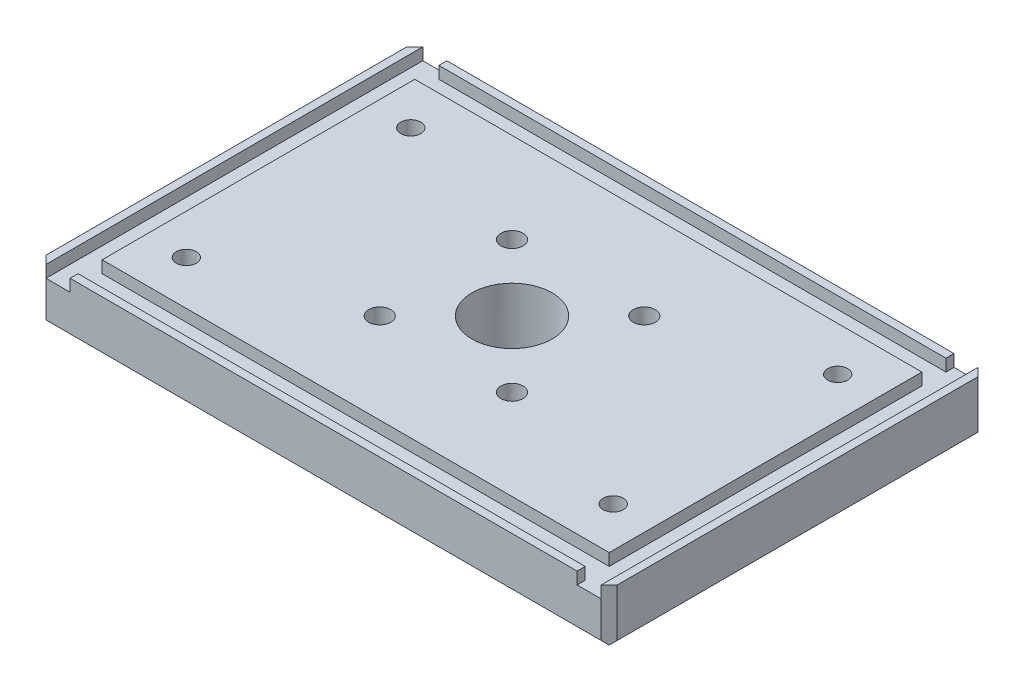
from build123d import *

# Parameters (mm, degrees)
SKETCH1_W           = 142.5
SKETCH1_H           = 94
BOSS_EXTRUDE1_DEPTH = 15
SKETCH2_W           = 126.5
SKETCH2_H           = 78
CUT_EXTRUDE2_DEPTH  = 3
CHAMFER1_SIZE       = 2
SKETCH6_R           = 2.5
CUT_EXTRUDE7_DEPTH  = 10
SKETCH7_R           = 5
CUT_EXTRUDE8_DEPTH  = 5
CHAMFER2_SIZE       = 3
SKETCH8_R           = 10
CUT_EXTRUDE9_DEPTH  = 15
CUT_EXTRUDE10_DEPTH = 172.368754445


# Some blends are built 0.0001 mm under size
with BuildPart() as part:
    # Sketch1 → Boss-Extrude1 (new body)
    with BuildSketch(Plane(origin=(0, 0, 0), x_dir=(1, 0, 0), z_dir=(0, 1, 0))):
        with Locations((71.25, 47)):
            Rectangle(SKETCH1_W, SKETCH1_H)
    extrude(amount=BOSS_EXTRUDE1_DEPTH)

    # Sketch2 → Cut-Extrude2 (cut)
    with BuildSketch(Plane(origin=(0, 15, 0), x_dir=(1, 0, 0), z_dir=(0, 1, 0))):
        Polygon((134.5, 92), (8, 92), (8, 94), (2, 94), (2, 0), (8, 0), (8, 2), (134.5, 2), (134.5, 0), (140.5, 0), (140.5, 94), (134.5, 94), align=None)
        with Locations((71.25, 47)):
            Rectangle(SKETCH2_W, SKETCH2_H, mode=Mode.SUBTRACT)
    extrude(amount=-CUT_EXTRUDE2_DEPTH, mode=Mode.SUBTRACT)

    # Chamfer1
    chamfer1_edges = [part.edges().sort_by_distance(p)[0] for p in [
        (0, 7.5, 0),
        (0, 7.5, -94),
        (142.5, 7.5, -94),
        (142.5, 7.5, 0),
    ]]
    chamfer(chamfer1_edges, length=CHAMFER1_SIZE - 0.0001)  # a hair under: the kernel refuses the full size

    # Sketch6 → Cut-Extrude7 (cut)
    with BuildSketch(Plane(origin=(0, 15, 0), x_dir=(1, 0, 0), z_dir=(0, 1, 0))):
        with Locations(Location((124.5, 75, 0), (0, 0, 270))):
            Circle(SKETCH6_R)
        with Locations(Location((18, 75, 0), (0, 0, 270))):
            Circle(SKETCH6_R)
        with Locations(Location((18, 19, 0), (0, 0, 270))):
            Circle(SKETCH6_R)
        with Locations(Location((124.5, 19, 0), (0, 0, 270))):
            Circle(SKETCH6_R)
    extrude(amount=-CUT_EXTRUDE7_DEPTH, mode=Mode.SUBTRACT)

    # Sketch7 → Cut-Extrude8 (cut)
    with BuildSketch(Plane.XZ):
        with Locations(Location((18, -19, 0), (0, 0, 270))):
            Circle(SKETCH7_R)
        with Locations(Location((124.5, -19, 0), (0, 0, 270))):
            Circle(SKETCH7_R)
        with Locations(Location((18, -75, 0), (0, 0, 270))):
            Circle(SKETCH7_R)
        with Locations(Location((124.5, -75, 0), (0, 0, 270))):
            Circle(SKETCH7_R)
    extrude(amount=-CUT_EXTRUDE8_DEPTH, mode=Mode.SUBTRACT)

    # Chamfer2
    # the kernel refuses this chamfer: 3 mm, written as the material it takes off along each edge
    with BuildSketch(Plane(origin=(142.5, 0, 5.715148964), x_dir=(-0.9996219169112968, -0.027495876610586487, 0), z_dir=(0, 0, -1)), Plane(origin=(0, 0, -99.715148964), x_dir=(0.9996219169112968, -0.027495876610586372, 0), z_dir=(0, 0, 1))) as chamfer2_piece_1:
        Polygon((CHAMFER2_SIZE * 0.999621916911, CHAMFER2_SIZE * 0.0274958766106), (-CHAMFER2_SIZE * 0.0274958766106, CHAMFER2_SIZE * 0.999621916911), (0, 0), align=None)
    extrude(amount=105.430297928, mode=Mode.SUBTRACT)
    with BuildSketch(Plane(origin=(-5.715148964, 0, 0), x_dir=(0, 0.9996219169112968, 0.027495876610586372), z_dir=(1, 0, 0))) as chamfer2_piece_2:
        Polygon((CHAMFER2_SIZE * 0.999621916911, -CHAMFER2_SIZE * 0.0274958766106), (-CHAMFER2_SIZE * 0.0274958766106, -CHAMFER2_SIZE * 0.999621916911), (0, 0), align=None)
    extrude(amount=153.930297928, mode=Mode.SUBTRACT)
    with BuildSketch(Plane(origin=(148.215148964, 0, -94), x_dir=(0, -0.02749587661058636, 0.9996219169112968), z_dir=(-1, 0, 0))) as chamfer2_piece_3:
        Polygon((CHAMFER2_SIZE * 0.999621916911, CHAMFER2_SIZE * 0.0274958766106), (-CHAMFER2_SIZE * 0.0274958766106, CHAMFER2_SIZE * 0.999621916911), (0, 0), align=None)
    extrude(amount=153.930297928, mode=Mode.SUBTRACT)

    # Sketch8 → Cut-Extrude9 (cut)
    with BuildSketch(Plane(origin=(0, 15, 0), x_dir=(1, 0, 0), z_dir=(0, 1, 0))):
        with Locations(Location((71.25, 47, 0), (0, 0, 270))):
            Circle(SKETCH8_R)
    extrude(amount=-CUT_EXTRUDE9_DEPTH, mode=Mode.SUBTRACT)

    # Sketch9 → Cut-Extrude10 (cut, through all)
    with BuildSketch(Plane(origin=(0, 15, 0), x_dir=(1, 0, 0), z_dir=(0, 1, 0))):
        with BuildLine():
            Line((54.75, 60.75), (54.75, 63.5))
            Line((54.75, 63.5), (57.5, 63.5))
            ThreePointArc((57.5, 63.5), (52.805456352, 65.444543648), (54.75, 60.75))
        make_face()
        with BuildLine():
            Line((57.5, 63.5), (54.75, 63.5))
            Line((54.75, 63.5), (54.75, 60.75))
            ThreePointArc((54.75, 60.75), (56.694543648, 61.555456352), (57.5, 63.5))
        make_face()
        with BuildLine():
            ThreePointArc((57.5, 30.5), (56.694543648, 32.444543648), (54.75, 33.25))
            Line((54.75, 33.25), (54.75, 30.5))
            Line((54.75, 30.5), (57.5, 30.5))
        make_face()
        with BuildLine():
            Line((54.75, 30.5), (54.75, 33.25))
            ThreePointArc((54.75, 33.25), (52.805456352, 28.555456352), (57.5, 30.5))
            Line((57.5, 30.5), (54.75, 30.5))
        make_face()
        with BuildLine():
            ThreePointArc((90.5, 30.5), (89.694543648, 32.444543648), (87.75, 33.25))
            Line((87.75, 33.25), (87.75, 30.5))
            Line((87.75, 30.5), (85, 30.5))
            ThreePointArc((85, 30.5), (87.75, 27.75), (90.5, 30.5))
        make_face()
        with BuildLine():
            Line((87.75, 30.5), (87.75, 33.25))
            ThreePointArc((87.75, 33.25), (85.805456352, 32.444543648), (85, 30.5))
            Line((85, 30.5), (87.75, 30.5))
        make_face()
        with BuildLine():
            ThreePointArc((90.5, 63.5), (87.75, 66.25), (85, 63.5))
            Line((85, 63.5), (87.75, 63.5))
            Line((87.75, 63.5), (87.75, 60.75))
            ThreePointArc((87.75, 60.75), (89.694543648, 61.555456352), (90.5, 63.5))
        make_face()
        with BuildLine():
            Line((87.75, 63.5), (85, 63.5))
            ThreePointArc((85, 63.5), (85.805456352, 61.555456352), (87.75, 60.75))
            Line((87.75, 60.75), (87.75, 63.5))
        make_face()
    extrude(amount=-CUT_EXTRUDE10_DEPTH, mode=Mode.SUBTRACT)


solid = part.part
